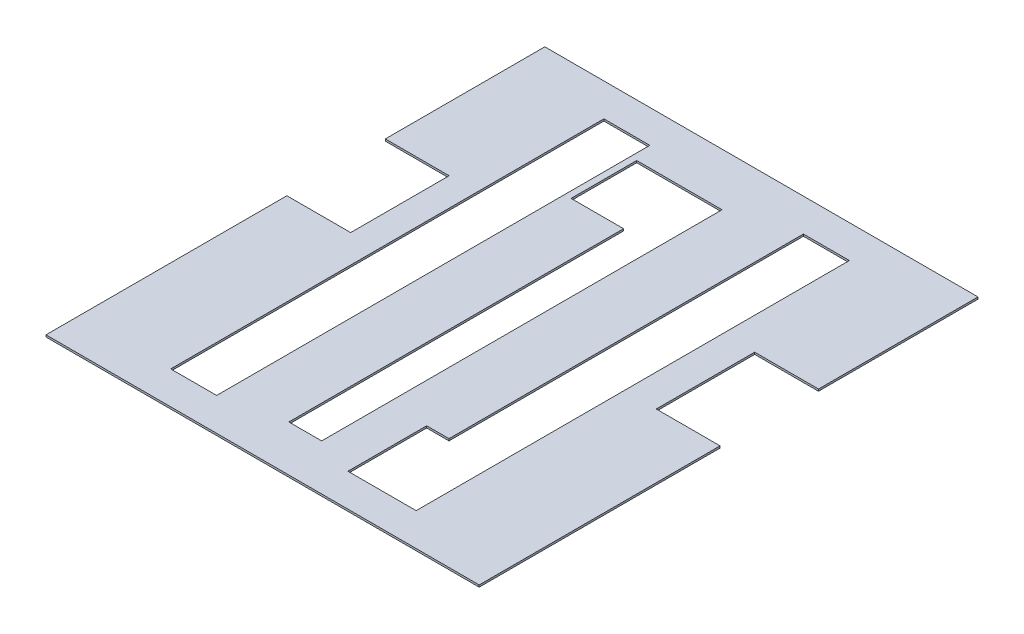
from build123d import *

# Parameters (mm, degrees)
SKETCH1_W           = 330
SKETCH1_H           = 380
BOSS_EXTRUDE1_DEPTH = 1.5
SKETCH2_W           = 48.6
SKETCH2_H           = 75
CUT_EXTRUDE1_DEPTH  = 10
SKETCH3_W           = 35
SKETCH3_H           = 330
CUT_EXTRUDE2_DEPTH  = 10
SKETCH7_W           = 17
SKETCH7_H           = 60
CUT_EXTRUDE5_DEPTH  = 10


with BuildPart() as part:
    # Sketch1 → Boss-Extrude1 (new body)
    with BuildSketch(Plane(origin=(0, 0, 0), x_dir=(1, 0, 0), z_dir=(0, 1, 0))):
        with Locations((6176.084066999, -8762.312377786)):
            Rectangle(SKETCH1_W, SKETCH1_H)
    extrude(amount=BOSS_EXTRUDE1_DEPTH)

    # Sketch2 → Cut-Extrude1 (cut)
    with BuildSketch(Plane(origin=(0, 1.5, 0), x_dir=(1, 0, 0), z_dir=(0, 1, 0))):
        with Locations((6035.384066999, -8731.312377786)):
            Rectangle(SKETCH2_W, SKETCH2_H)
        with Locations((6316.784066999, -8731.312377786)):
            Rectangle(SKETCH2_W, SKETCH2_H)
    extrude(amount=-CUT_EXTRUDE1_DEPTH, mode=Mode.SUBTRACT)

    # Sketch3 → Cut-Extrude2 (cut)
    with BuildSketch(Plane(origin=(0, 1.5, 0), x_dir=(1, 0, 0), z_dir=(0, 1, 0))):
        with Locations((6250.584066999, -8762.312377786)):
            Rectangle(SKETCH3_W, SKETCH3_H)
        Polygon((6161.084066999, -8662.312377786), (6161.084066999, -8917.312377786), (6186.084066999, -8917.312377786), (6186.084066999, -8612.312377786), (6121.084066999, -8612.312377786), (6121.084066999, -8662.312377786), align=None)
        with Locations((6098.584066999, -8762.312377786)):
            Rectangle(SKETCH3_W, SKETCH3_H)
    extrude(amount=-CUT_EXTRUDE2_DEPTH, mode=Mode.SUBTRACT)

    # Sketch7 → Cut-Extrude5 (cut)
    with BuildSketch(Plane(origin=(0, 1.5, 0), x_dir=(1, 0, 0), z_dir=(0, 1, 0))):
        with Locations((6224.584066999, -8897.312377786)):
            Rectangle(SKETCH7_W, SKETCH7_H)
    extrude(amount=-CUT_EXTRUDE5_DEPTH, mode=Mode.SUBTRACT)


solid = part.part
